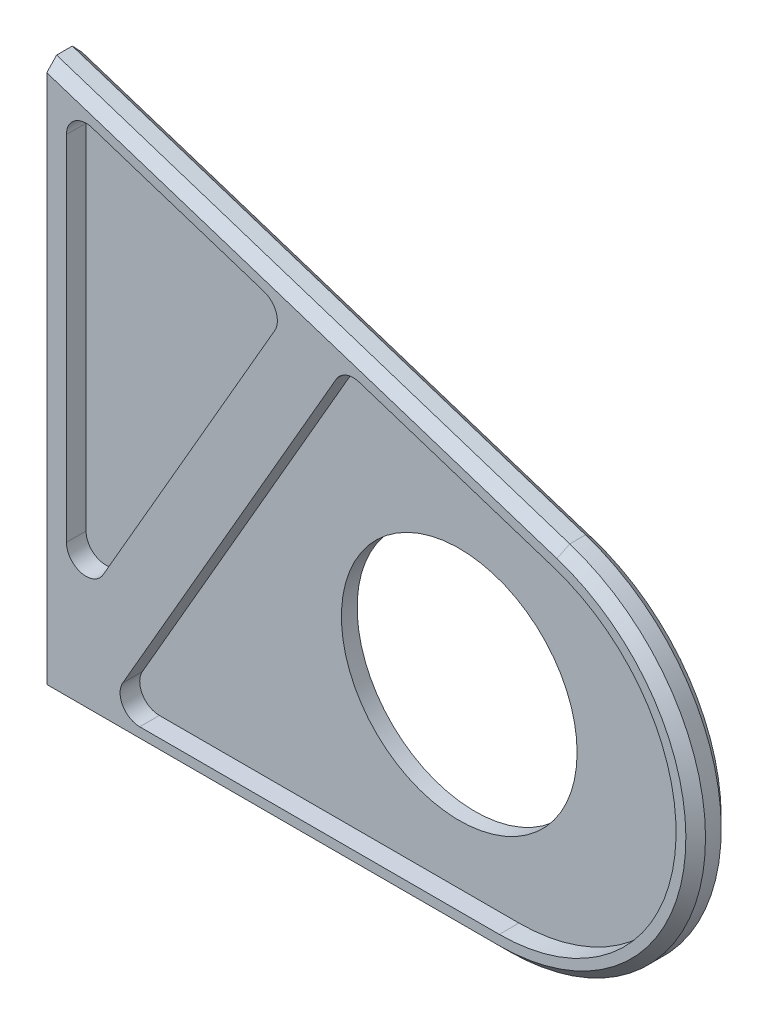
from build123d import *

# Parameters (mm, degrees)
SKETCH_1_R      = 60
EXTRUDE_1_DEPTH = 8
FILLET_1_R      = 100
EXTRUDE_START   = 10
EXTRUDE_2_DEPTH = 10
FILLET_2_R      = 10
CHAMFER_1_SIZE  = 5


with BuildPart() as part:
    # 草图1 → 凸台-拉伸1 (new body)
    with BuildSketch(Plane.XY):
        Polygon((0, 0), (0, 280), (861.751390409, 0), align=None)
        with Locations((200, 100)):
            Circle(SKETCH_1_R, mode=Mode.SUBTRACT)
    extrude(amount=EXTRUDE_1_DEPTH)

    # 圆角1
    fillet_1_edges = [part.edges().sort_by_distance(p)[0] for p in [
        (861.751390409, 0, 4),
    ]]
    fillet(fillet_1_edges, radius=FILLET_1_R)

    # 草图2 → 凸台-拉伸2 (add)
    with BuildSketch(Plane.XY.offset(8).offset(EXTRUDE_START)):
        with BuildLine():
            Line((0, 0), (230.376238942, 0))
            ThreePointArc((230.376238942, 0), (329.145073001, 84.356553496), (261.277938379, 195.10565163))
            Line((261.277938379, 195.10565163), (0, 280))
            Line((0, 280), (0, 0))
        make_face()
        Polygon((10, 266.236180795), (10, 35.358983849), (122.241374643, 229.766747442), align=None, mode=Mode.SUBTRACT)
        with BuildLine():
            Line((30, 10), (230.376238942, 10))
            ThreePointArc((230.376238942, 10), (319.268189595, 85.920898146), (258.187768435, 185.595086467))
            Line((258.187768435, 185.595086467), (151.410485182, 220.289128906))
            Line((151.410485182, 220.289128906), (30, 10))
        make_face(mode=Mode.SUBTRACT)
    extrude(amount=-EXTRUDE_2_DEPTH)

    # 圆角2
    fillet_2_edges = [part.edges().sort_by_distance(p)[0] for p in [
        (10, 35.358983849, 13),
        (30, 10, 13),
        (122.241374643, 229.766747442, 13),
        (151.410485182, 220.289128906, 13),
        (10, 266.236180795, 13),
    ]]
    fillet(fillet_2_edges, radius=FILLET_2_R)

    # 倒角1
    chamfer_1_edges = [part.edges().sort_by_distance(p)[0] for p in [
        (130.63896919, 237.552825815, 0),
        (115.188119471, 0, 0),
        (329.145073001, 84.356553496, 0),
        (115.188119471, 0, 18),
        (130.63896919, 237.552825815, 18),
        (329.145073001, 84.356553496, 18),
    ]]
    chamfer(chamfer_1_edges, length=CHAMFER_1_SIZE)


solid = part.part
